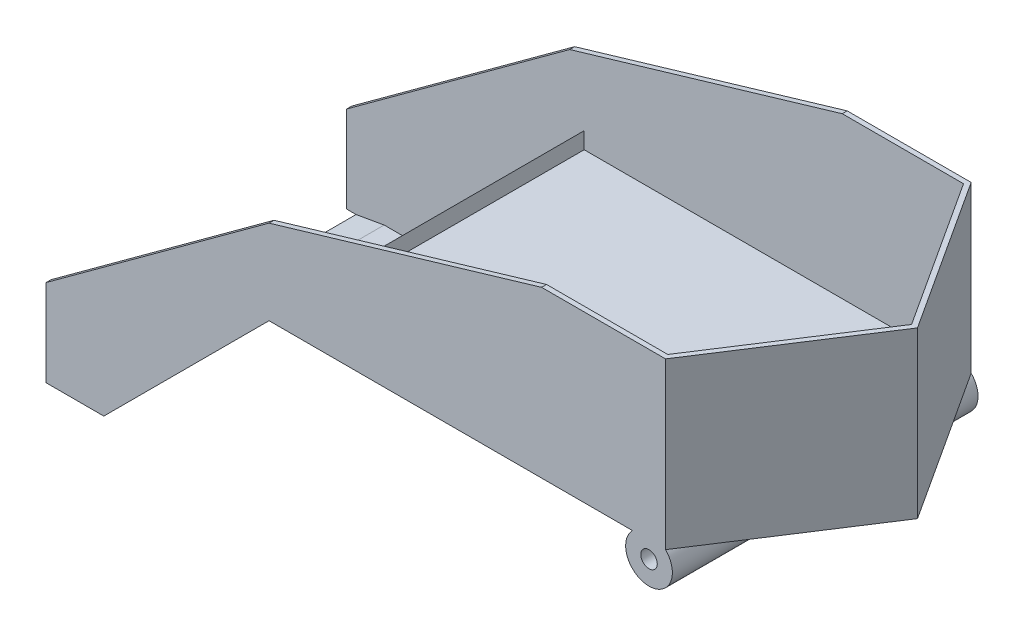
from build123d import *

# Parameters (mm, degrees)
BOSS_EXTRUDE1_DEPTH = 100
SHELL1_T            = -3
SKETCH2_W           = 3
SKETCH2_H           = 179
CUT_EXTRUDE1_DEPTH  = 97
CUT_EXTRUDE2_DEPTH  = 367.367302034
SKETCH4_R           = 5
BOSS_EXTRUDE2_DEPTH = 185
BOSS_EXTRUDE3_REACH = 368.367
SHELL2_START        = -182
SHELL2_DEPTH        = 179
SKETCH6_W           = 8.912859495
SKETCH6_H           = 179
CUT_EXTRUDE3_DEPTH  = 10
CHAMFER1_SIZE       = 4
CHAMFER1_SIZE_2     = 22.685127278
BOSS_EXTRUDE4_REACH = 366.862


# Read off the part's stored shape, not the designer's step: Shell2
with BuildPart() as part:
    # Sketch1 → Boss-Extrude1 (new body)
    with BuildSketch(Plane(origin=(0, 0, 0), x_dir=(1, 0, 0), z_dir=(0, 1, 0))):
        Polygon((240, 185), (300, 92.5), (240, 0), (0, 0), (0, 185), align=None)
    extrude(amount=BOSS_EXTRUDE1_DEPTH)

    # Shell1
    shell1_openings = [part.faces().sort_by_distance(p)[0] for p in [
        (135.555555556, 100, -92.5),
    ]]
    offset(amount=SHELL1_T, openings=shell1_openings, kind=Kind.INTERSECTION)

    # Sketch2 → Cut-Extrude1 (cut)
    with BuildSketch(Plane(origin=(0, 100, 0), x_dir=(1, 0, 0), z_dir=(0, 1, 0))):
        with Locations((1.5, 92.5)):
            Rectangle(SKETCH2_W, SKETCH2_H)
    extrude(amount=-CUT_EXTRUDE1_DEPTH, mode=Mode.SUBTRACT)

    # Sketch3 → Cut-Extrude2 (cut, through all)
    with BuildSketch(Plane.XY):
        Polygon((0, 100), (0, 51.158972719), (164.988073302, 100), align=None)
    extrude(amount=-CUT_EXTRUDE2_DEPTH, mode=Mode.SUBTRACT)

    # Sketch4 → Boss-Extrude2 (add)
    with BuildSketch(Plane.XY):
        with BuildLine():
            Line((220, 0), (240, 0))
            ThreePointArc((240, 0), (230, -24.142135624), (220, 0))
        make_face()
        with Locations((230, -10)):
            Circle(SKETCH4_R, mode=Mode.SUBTRACT)
    extrude(amount=-BOSS_EXTRUDE2_DEPTH)

    # Boss-Extrude3: up to this face of the body (flat: up to its plane)
    boss_extrude3_end = Plane(part.part.faces().sort_by_distance((135.447130894, 41.883724311, -185))[0])
    # Sketch5 → Boss-Extrude3 (add, up to the picked face)
    with BuildSketch(Plane.XY, mode=Mode.PRIVATE) as boss_extrude3_sk1:
        Polygon((0, 51.158972719), (-135, -47.5), (-135, -100), (-100, -100), (0, 0), align=None)
    boss_extrude3_tool1 = split(extrude(boss_extrude3_sk1.sketch, amount=-BOSS_EXTRUDE3_REACH, mode=Mode.PRIVATE), bisect_by=boss_extrude3_end, keep=Keep.BOTH, mode=Mode.PRIVATE)
    add(boss_extrude3_tool1.solids().sort_by(Axis((-69.900259, -32.775799, 0), (0, 0, -1)))[0])

    # Shell2 outline → Shell2 (cut)
    with BuildSketch(Plane.XY.offset(SHELL2_START)):
        Polygon((0, 48.030284306), (-7.196033451, 45.900059624), (-135, -47.5), (-135, -97), (-101.242640687, -97), (-1.242640687, 3), (0, 3), align=None)
    extrude(amount=SHELL2_DEPTH, mode=Mode.SUBTRACT)

    # Sketch6 → Cut-Extrude3 (cut)
    with BuildSketch(Plane(origin=(-24.371197118, 33.348326263, 0), x_dir=(0.8073765164894111, 0.5900365756641057, 0), z_dir=(-0.5900365756641056, 0.8073765164894111, 0))):
        with Locations((25.729235331, 92.5)):
            Rectangle(SKETCH6_W, SKETCH6_H)
    extrude(amount=-CUT_EXTRUDE3_DEPTH, mode=Mode.SUBTRACT)

    # Chamfer1
    # the kernel refuses this chamfer: 22.685127278, 4 mm, written as the material it takes off along each edge
    with BuildSketch(Plane(origin=(-135, -97, -182), x_dir=(-0.21013876076735197, -0.9776715712462758, 0), z_dir=(0, 0, 1))) as chamfer1_piece_1:
        Polygon((CHAMFER1_SIZE * 0.977671571246, CHAMFER1_SIZE * 0.210138760767), (-CHAMFER1_SIZE_2 * 0.210138760772, CHAMFER1_SIZE_2 * 0.977671571267), (0, 0), align=None)
    extrude(amount=179, mode=Mode.SUBTRACT)

    # Sketch8 → Boss-Extrude4 (add, up to next)
    with BuildSketch(Plane.XY.offset(-182), mode=Mode.PRIVATE) as boss_extrude4_sk1:
        Polygon((-1.242640687, 3), (8.757359313, 13), (8.757359313, 3), align=None)
    boss_extrude4_tool1 = extrude(boss_extrude4_sk1.sketch, amount=BOSS_EXTRUDE4_REACH, mode=Mode.PRIVATE) - part.part
    add(boss_extrude4_tool1.solids().sort_by_distance((5.424026, 6.333333, -182))[0])


solid = part.part
